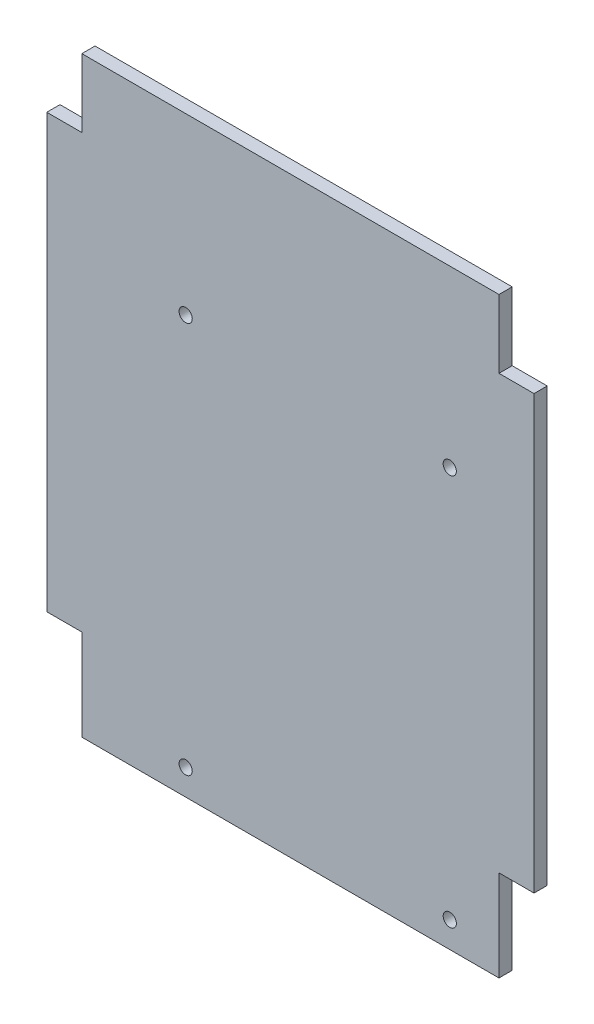
from build123d import *

# Parameters (mm, degrees)
SKETCH1_R           = 1.45
BOSS_EXTRUDE2_DEPTH = 2.9


with BuildPart() as part:
    # Sketch1 → Boss-Extrude2 (new body)
    with BuildSketch(Plane.XY):
        Polygon((-53.5, -47.5), (-45.8, -47.5), (-45.8, -67.5), (45.8, -67.5), (45.8, -47.5), (53.5, -47.5), (53.5, 47.5), (45.803905178, 47.5), (45.803905178, 62.5), (-45.8, 62.5), (-45.8, 47.5), (-53.5, 47.5), align=None)
        with Locations((35, -61.82140141)):
            Circle(SKETCH1_R, mode=Mode.SUBTRACT)
        with Locations((35, 24.17859859)):
            Circle(SKETCH1_R, mode=Mode.SUBTRACT)
        with Locations((-23, -61.82140141)):
            Circle(SKETCH1_R, mode=Mode.SUBTRACT)
        with Locations((-23, 24.17859859)):
            Circle(SKETCH1_R, mode=Mode.SUBTRACT)
    extrude(amount=BOSS_EXTRUDE2_DEPTH)


solid = part.part
